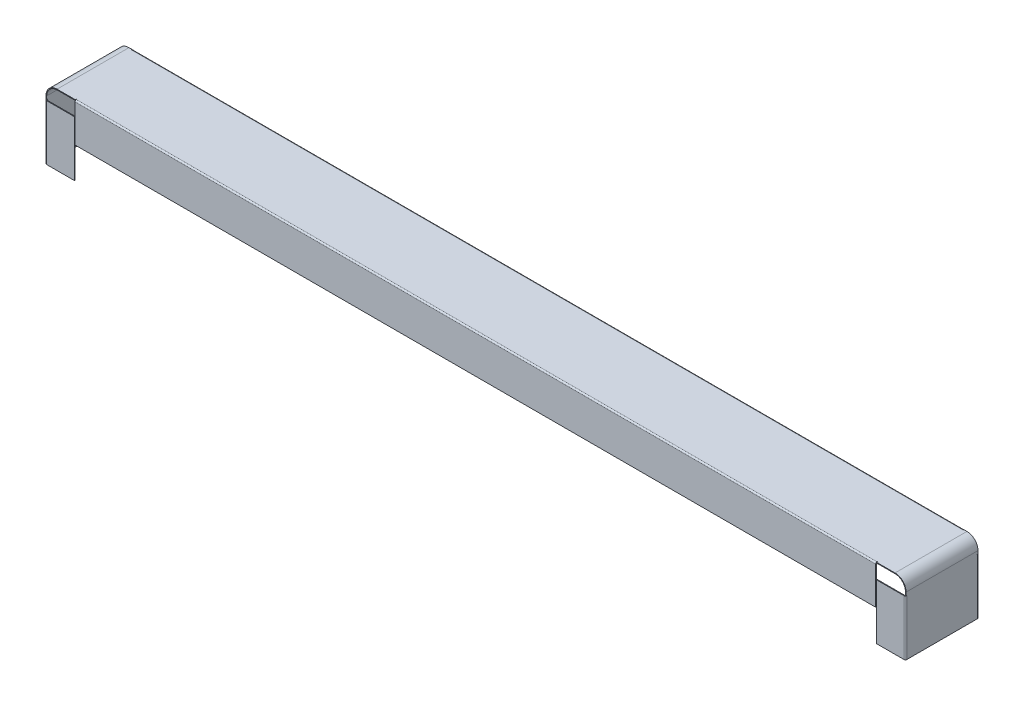
from build123d import *

# Parameters (mm, degrees)
BASE_FLANGE1_DEPTH             = 104
EDGE_FLANGE1_STRIP_W           = 6
EDGE_FLANGE1_STRIP_H           = 1
EDGE_FLANGE1_STRIP_CUT_DEPTH   = 1202
EDGE_FLANGE1_RELIEF_W          = 6.5
EDGE_FLANGE1_RELIEF_H          = 0.5
EDGE_FLANGE1_RELIEF_CUT_DEPTH  = 1
EDGE_FLANGE1_DEPTH             = 1202
EDGE_FLANGE2_STRIP_W           = 6
EDGE_FLANGE2_STRIP_H           = 1
EDGE_FLANGE2_STRIP_CUT_DEPTH   = 1202
EDGE_FLANGE2_DEPTH             = 1202
EDGE_FLANGE3_STRIP_W           = 6
EDGE_FLANGE3_STRIP_H           = 1
EDGE_FLANGE3_STRIP_CUT_DEPTH   = 80
EDGE_FLANGE3_RELIEF_W          = 6.5
EDGE_FLANGE3_RELIEF_H          = 0.5
EDGE_FLANGE3_RELIEF_CUT_DEPTH  = 1
EDGE_FLANGE3_DEPTH             = 80
EDGE_FLANGE4_STRIP_W           = 6
EDGE_FLANGE4_STRIP_H           = 1
EDGE_FLANGE4_STRIP_CUT_DEPTH   = 80
EDGE_FLANGE4_DEPTH             = 80
EDGE_FLANGE5_STRIP_W           = 6
EDGE_FLANGE5_STRIP_H           = 1
EDGE_FLANGE5_STRIP_CUT_DEPTH   = 1158
EDGE_FLANGE5_RELIEF_W          = 6.5
EDGE_FLANGE5_RELIEF_H          = 0.5
EDGE_FLANGE5_RELIEF_CUT_DEPTH  = 1
EDGE_FLANGE5_DEPTH             = 1158
EDGE_FLANGE6_STRIP_W           = 6
EDGE_FLANGE6_STRIP_H           = 1
EDGE_FLANGE6_STRIP_CUT_DEPTH   = 80
EDGE_FLANGE6_RELIEF_W          = 6.5
EDGE_FLANGE6_RELIEF_H          = 0.5
EDGE_FLANGE6_RELIEF_CUT_DEPTH  = 1
EDGE_FLANGE6_DEPTH             = 80
SKETCH25_R                     = 3
CUT_EXTRUDE1_DEPTH             = 3
SKETCH26_R                     = 3
CUT_EXTRUDE2_DEPTH             = 3
CUT_EXTRUDE2_DIRECTION_2_REACH = 1234.559


# Sheet-metal steps are written as plain solids
with BuildPart() as part:
    # Sketch1 → Base-Flange1 (new body)
    with BuildSketch(Plane.XY):
        with BuildLine():
            Line((-621, -100), (-621, -15))
            ThreePointArc((-621, -15), (-616.606601718, -4.393398282), (-606, 0))
            Line((-606, 0), (606, 0))
            ThreePointArc((606, 0), (616.606601718, -4.393398282), (621, -15))
            Line((621, -15), (621, -100))
            Line((621, -100), (622, -100))
            Line((622, -100), (622, -15))
            ThreePointArc((622, -15), (617.313708499, -3.686291501), (606, 1))
            Line((606, 1), (-606, 1))
            ThreePointArc((-606, 1), (-617.313708499, -3.686291501), (-622, -15))
            Line((-622, -15), (-622, -100))
            Line((-622, -100), (-621, -100))
        make_face()
    extrude(amount=BASE_FLANGE1_DEPTH)

    # Edge-Flange1 strip (across the edge) → Edge-Flange1 strip cut (cut)
    with BuildSketch(Plane(origin=(-601, 0, 0), x_dir=(0, 0, 1), z_dir=(1, 0, 0))):
        with Locations((-2, -0.5)):
            Rectangle(EDGE_FLANGE1_STRIP_W, EDGE_FLANGE1_STRIP_H)
    extrude(amount=EDGE_FLANGE1_STRIP_CUT_DEPTH, mode=Mode.SUBTRACT)

    # Edge-Flange1 relief (on the sheet) → Edge-Flange1 relief cut (cut)
    with BuildSketch(Plane(origin=(-601, 0, 1), x_dir=(0, 0, 1), z_dir=(0, -1, 0))):
        with Locations((-2.75, 0.25)):
            Rectangle(EDGE_FLANGE1_RELIEF_W, EDGE_FLANGE1_RELIEF_H)
        with Locations((-2.75, -1202.25)):
            Rectangle(EDGE_FLANGE1_RELIEF_W, EDGE_FLANGE1_RELIEF_H)
    extrude(amount=-EDGE_FLANGE1_RELIEF_CUT_DEPTH, mode=Mode.SUBTRACT)

    # Edge-Flange1 section (across the edge) → Edge-Flange1 (add)
    with BuildSketch(Plane(origin=(-601, 0, 0), x_dir=(0, 0, 1), z_dir=(1, 0, 0))):
        with BuildLine():
            Line((-1, 1), (-1, 19))
            Line((-1, 19), (0, 19))
            Line((0, 19), (0, 1))
            ThreePointArc((0, 1), (0.292893219, 0.292893219), (1, 0))
            Line((1, 0), (1, -1))
            ThreePointArc((1, -1), (-0.414213562, -0.414213562), (-1, 1))
        make_face()
    extrude(amount=EDGE_FLANGE1_DEPTH)

    # Edge-Flange2 strip (across the edge) → Edge-Flange2 strip cut (cut)
    with BuildSketch(Plane(origin=(-601, -19, 0), x_dir=(0, 1, 0), z_dir=(1, 0, 0))):
        with Locations((-1, -0.5)):
            Rectangle(EDGE_FLANGE2_STRIP_W, EDGE_FLANGE2_STRIP_H)
    extrude(amount=EDGE_FLANGE2_STRIP_CUT_DEPTH, mode=Mode.SUBTRACT)

    # Edge-Flange2 section (across the edge) → Edge-Flange2 (add)
    with BuildSketch(Plane(origin=(-601, -19, 0), x_dir=(0, 1, 0), z_dir=(1, 0, 0))):
        with BuildLine():
            Line((0, 1), (0, 18))
            Line((0, 18), (1, 18))
            Line((1, 18), (1, 1))
            ThreePointArc((1, 1), (1.292893219, 0.292893219), (2, 0))
            Line((2, 0), (2, -1))
            ThreePointArc((2, -1), (0.585786438, -0.414213562), (0, 1))
        make_face()
    extrude(amount=EDGE_FLANGE2_DEPTH)

    # Edge-Flange3 strip (across the edge) → Edge-Flange3 strip cut (cut)
    with BuildSketch(Plane(origin=(-621, -100, 0), x_dir=(0, 0, 1), z_dir=(0, 1, 0))):
        with Locations((-2, -0.5)):
            Rectangle(EDGE_FLANGE3_STRIP_W, EDGE_FLANGE3_STRIP_H)
    edge_flange3_strip_cut = extrude(amount=EDGE_FLANGE3_STRIP_CUT_DEPTH, mode=Mode.SUBTRACT)

    # Edge-Flange3 relief (on the sheet) → Edge-Flange3 relief cut (cut)
    with BuildSketch(Plane(origin=(-621, -100, 1), x_dir=(0, 0, 1), z_dir=(1, 0, 0))):
        with Locations((-2.75, -80.25)):
            Rectangle(EDGE_FLANGE3_RELIEF_W, EDGE_FLANGE3_RELIEF_H)
    edge_flange3_relief_cut = extrude(amount=-EDGE_FLANGE3_RELIEF_CUT_DEPTH, mode=Mode.SUBTRACT)

    # Edge-Flange3 section (across the edge) → Edge-Flange3 (add)
    with BuildSketch(Plane(origin=(-621, -100, 0), x_dir=(0, 0, 1), z_dir=(0, 1, 0))):
        with BuildLine():
            Line((-1, 1), (-1, 19))
            Line((-1, 19), (0, 19))
            Line((0, 19), (0, 1))
            ThreePointArc((0, 1), (0.292893219, 0.292893219), (1, 0))
            Line((1, 0), (1, -1))
            ThreePointArc((1, -1), (-0.414213562, -0.414213562), (-1, 1))
        make_face()
    edge_flange3 = extrude(amount=EDGE_FLANGE3_DEPTH)

    # Edge-Flange4 strip (across the edge) → Edge-Flange4 strip cut (cut)
    with BuildSketch(Plane(origin=(-602, -100, 0), x_dir=(-1, 0, 0), z_dir=(0, 1, 0))):
        with Locations((-1, -0.5)):
            Rectangle(EDGE_FLANGE4_STRIP_W, EDGE_FLANGE4_STRIP_H)
    edge_flange4_strip_cut = extrude(amount=EDGE_FLANGE4_STRIP_CUT_DEPTH, mode=Mode.SUBTRACT)

    # Edge-Flange4 section (across the edge) → Edge-Flange4 (add)
    with BuildSketch(Plane(origin=(-602, -100, 0), x_dir=(-1, 0, 0), z_dir=(0, 1, 0))):
        with BuildLine():
            Line((0, 1), (0, 18))
            Line((0, 18), (1, 18))
            Line((1, 18), (1, 1))
            ThreePointArc((1, 1), (1.292893219, 0.292893219), (2, 0))
            Line((2, 0), (2, -1))
            ThreePointArc((2, -1), (0.585786438, -0.414213562), (0, 1))
        make_face()
    edge_flange4 = extrude(amount=EDGE_FLANGE4_DEPTH)

    # Mirror1: Edge-Flange3 strip cut, Edge-Flange3 relief cut, Edge-Flange3, Edge-Flange4 strip cut, Edge-Flange4 across plane
    add(edge_flange3_strip_cut.mirror(Plane(origin=(0, 0, 0), x_dir=(0, 0, 1), z_dir=(1, 0, 0))), mode=Mode.SUBTRACT)
    add(edge_flange3_relief_cut.mirror(Plane(origin=(0, 0, 0), x_dir=(0, 0, 1), z_dir=(1, 0, 0))), mode=Mode.SUBTRACT)
    add(edge_flange3.mirror(Plane(origin=(0, 0, 0), x_dir=(0, 0, 1), z_dir=(1, 0, 0))))
    add(edge_flange4_strip_cut.mirror(Plane(origin=(0, 0, 0), x_dir=(0, 0, 1), z_dir=(1, 0, 0))), mode=Mode.SUBTRACT)
    add(edge_flange4.mirror(Plane(origin=(0, 0, 0), x_dir=(0, 0, 1), z_dir=(1, 0, 0))))

    # Edge-Flange5 strip (across the edge) → Edge-Flange5 strip cut (cut)
    with BuildSketch(Plane(origin=(579, 0, 104), x_dir=(0, 0, -1), z_dir=(-1, 0, 0))):
        with Locations((-2, -0.5)):
            Rectangle(EDGE_FLANGE5_STRIP_W, EDGE_FLANGE5_STRIP_H)
    extrude(amount=EDGE_FLANGE5_STRIP_CUT_DEPTH, mode=Mode.SUBTRACT)

    # Edge-Flange5 relief (on the sheet) → Edge-Flange5 relief cut (cut)
    with BuildSketch(Plane(origin=(579, 0, 103), x_dir=(0, 0, -1), z_dir=(0, -1, 0))):
        with Locations((-2.75, 0.25)):
            Rectangle(EDGE_FLANGE5_RELIEF_W, EDGE_FLANGE5_RELIEF_H)
        with Locations((-2.75, -1158.25)):
            Rectangle(EDGE_FLANGE5_RELIEF_W, EDGE_FLANGE5_RELIEF_H)
    extrude(amount=-EDGE_FLANGE5_RELIEF_CUT_DEPTH, mode=Mode.SUBTRACT)

    # Edge-Flange5 section (across the edge) → Edge-Flange5 (add)
    with BuildSketch(Plane(origin=(579, 0, 104), x_dir=(0, 0, -1), z_dir=(-1, 0, 0))):
        with BuildLine():
            Line((-1, 1), (-1, 55))
            Line((-1, 55), (0, 55))
            Line((0, 55), (0, 1))
            ThreePointArc((0, 1), (0.292893219, 0.292893219), (1, 0))
            Line((1, 0), (1, -1))
            ThreePointArc((1, -1), (-0.414213562, -0.414213562), (-1, 1))
        make_face()
    extrude(amount=EDGE_FLANGE5_DEPTH)

    # Edge-Flange6 strip (across the edge) → Edge-Flange6 strip cut (cut)
    with BuildSketch(Plane(origin=(621, -100, 104), x_dir=(0, 0, -1), z_dir=(0, 1, 0))):
        with Locations((-2, -0.5)):
            Rectangle(EDGE_FLANGE6_STRIP_W, EDGE_FLANGE6_STRIP_H)
    edge_flange6_strip_cut = extrude(amount=EDGE_FLANGE6_STRIP_CUT_DEPTH, mode=Mode.SUBTRACT)

    # Edge-Flange6 relief (on the sheet) → Edge-Flange6 relief cut (cut)
    with BuildSketch(Plane(origin=(621, -100, 103), x_dir=(0, 0, -1), z_dir=(-1, 0, 0))):
        with Locations((-2.75, -80.25)):
            Rectangle(EDGE_FLANGE6_RELIEF_W, EDGE_FLANGE6_RELIEF_H)
    edge_flange6_relief_cut = extrude(amount=-EDGE_FLANGE6_RELIEF_CUT_DEPTH, mode=Mode.SUBTRACT)

    # Edge-Flange6 section (across the edge) → Edge-Flange6 (add)
    with BuildSketch(Plane(origin=(621, -100, 104), x_dir=(0, 0, -1), z_dir=(0, 1, 0))):
        with BuildLine():
            Line((-1, 1), (-1, 41))
            Line((-1, 41), (0, 41))
            Line((0, 41), (0, 1))
            ThreePointArc((0, 1), (0.292893219, 0.292893219), (1, 0))
            Line((1, 0), (1, -1))
            ThreePointArc((1, -1), (-0.414213562, -0.414213562), (-1, 1))
        make_face()
    edge_flange6 = extrude(amount=EDGE_FLANGE6_DEPTH)

    # Mirror2: Edge-Flange6 strip cut, Edge-Flange6 relief cut, Edge-Flange6 across plane
    add(edge_flange6_strip_cut.mirror(Plane(origin=(0, 0, 0), x_dir=(0, 0, 1), z_dir=(1, 0, 0))), mode=Mode.SUBTRACT)
    add(edge_flange6_relief_cut.mirror(Plane(origin=(0, 0, 0), x_dir=(0, 0, 1), z_dir=(1, 0, 0))), mode=Mode.SUBTRACT)
    add(edge_flange6.mirror(Plane(origin=(0, 0, 0), x_dir=(0, 0, 1), z_dir=(1, 0, 0))))

    # Sketch25 → Cut-Extrude1 (cut)
    with BuildSketch(Plane.XZ.offset(19)):
        with Locations(Location((-540, 12, 0), (0, 0, 270))):
            Circle(SKETCH25_R)
        with Locations(Location((-360, 12, 0), (0, 0, 270))):
            Circle(SKETCH25_R)
        with Locations(Location((-180, 12, 0), (0, 0, 270))):
            Circle(SKETCH25_R)
        with Locations(Location((0, 12, 0), (0, 0, 270))):
            Circle(SKETCH25_R)
        with Locations(Location((180, 12, 0), (0, 0, 270))):
            Circle(SKETCH25_R)
        with Locations(Location((360, 12, 0), (0, 0, 270))):
            Circle(SKETCH25_R)
        with Locations(Location((540, 12, 0), (0, 0, 270))):
            Circle(SKETCH25_R)
    extrude(amount=-CUT_EXTRUDE1_DEPTH, mode=Mode.SUBTRACT)

    # Sketch26 → Cut-Extrude2 (cut)
    with BuildSketch(Plane(origin=(-602, 0, 0), x_dir=(0, 0, -1), z_dir=(1, 0, 0))):
        with Locations((-12, -68)):
            Circle(SKETCH26_R)
    extrude(amount=-CUT_EXTRUDE2_DEPTH, mode=Mode.SUBTRACT)

    # Cut-Extrude2 direction 2: up to this face of the body (flat: up to its plane)
    cut_extrude2_direction_2_end = Plane(part.part.faces().sort_by_distance((603, -60, 9.5))[0])
    # Sketch26 → Cut-Extrude2 direction 2 (cut, up to the picked face)
    with BuildSketch(Plane(origin=(-602, 0, 0), x_dir=(0, 0, -1), z_dir=(1, 0, 0)), mode=Mode.PRIVATE) as cut_extrude2_direction_2_sk1:
        with Locations((-12, -68)):
            Circle(SKETCH26_R)
    cut_extrude2_direction_2_tool1 = split(extrude(cut_extrude2_direction_2_sk1.sketch, amount=CUT_EXTRUDE2_DIRECTION_2_REACH, mode=Mode.PRIVATE), bisect_by=cut_extrude2_direction_2_end, keep=Keep.BOTH, mode=Mode.PRIVATE)
    add(cut_extrude2_direction_2_tool1.solids().sort_by(Axis((-602, -68, 12), (1, 0, 0)))[0], mode=Mode.SUBTRACT)


solid = part.part
